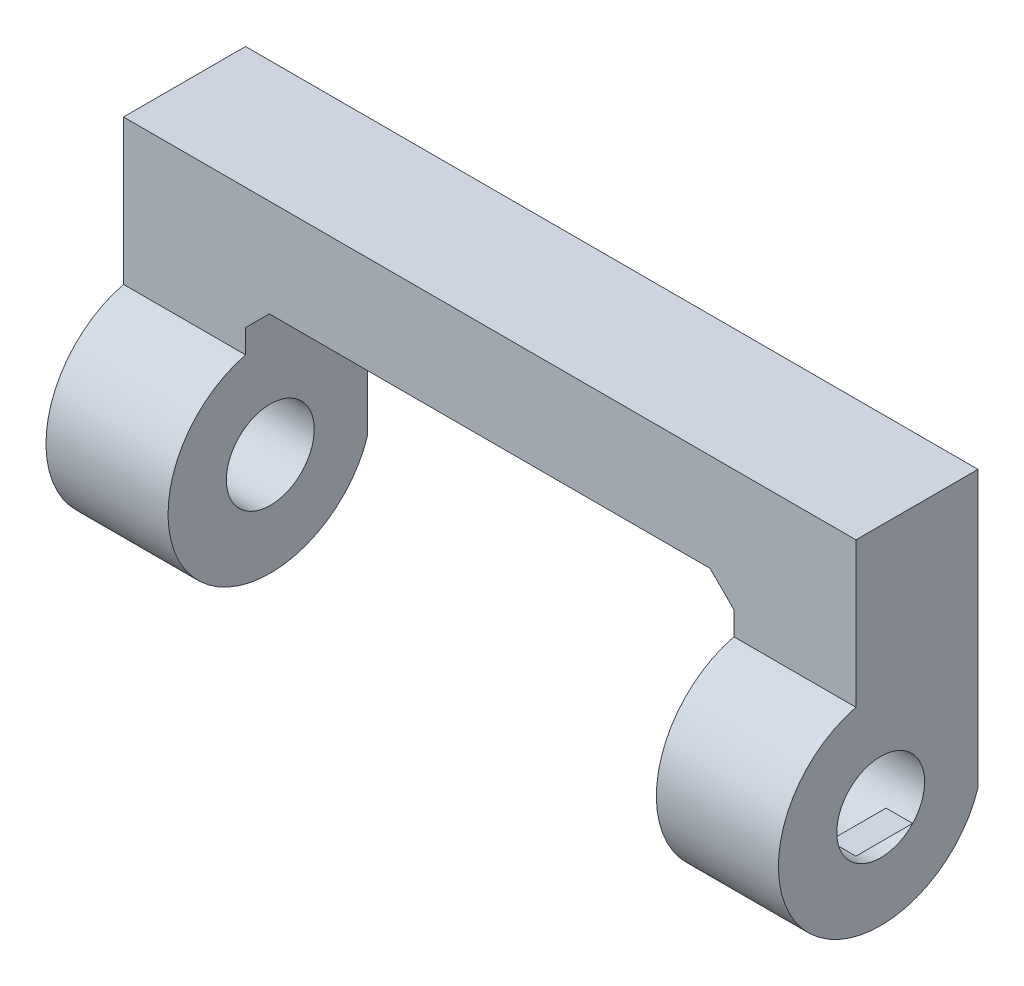
from build123d import *
from build123d.topology import SkipClean

# Parameters (mm, degrees)
BOSS_EXTRUDE1_DEPTH = 5
CUT_EXTRUDE1_DEPTH  = 50.648505088
SKETCH2_3_R         = 1.799674582
BOSS_EXTRUDE2_DEPTH = 5
SKETCH3_R           = 1.799674582
BOSS_EXTRUDE3_DEPTH = 5


with BuildPart() as part:
    # Model → Boss-Extrude1 (new body)
    with BuildSketch(Plane.XY):
        Polygon((319.643988705, 39.239445651), (289.639989597, 39.239424468), (289.639989597, 28.016886869), (294.639989597, 28.020075702), (294.639989597, 34.266605248), (295.614474597, 35.240900181), (304.640051213, 35.240024382), (313.667685024, 35.239144856), (314.643988705, 34.264659856), (314.643988705, 34.263422299), (314.643988705, 28.018126256), (319.643988705, 28.016541689), align=None)
    extrude(amount=BOSS_EXTRUDE1_DEPTH)

    # Sketch2 → Cut-Extrude1 (cut, through all)
    with BuildSketch(Plane.ZY.offset(-289.639989597)):
        with BuildLine():
            ThreePointArc((5, 30.738550482), (2.616874768, 30.420409758), (2.676683755, 28.016886869))
            Line((2.676683755, 28.016886869), (5, 28.016886869))
            Line((5, 28.016886869), (5, 30.738550482))
        make_face()
    extrude(amount=-CUT_EXTRUDE1_DEPTH, mode=Mode.SUBTRACT)

    # Sketch2<3> → Boss-Extrude2 (add)
    with BuildSketch(Plane.ZY.offset(-289.639989597)):
        with BuildLine():
            Line((0, 30.526457448), (0, 27.942741433))
            ThreePointArc((0, 27.942741433), (8.175740848, 29.23459944), (0, 30.526457448))
        make_face()
        with Locations((3.985657063, 29.251964795)):
            Circle(SKETCH2_3_R, mode=Mode.SUBTRACT)
    extrude(amount=-BOSS_EXTRUDE2_DEPTH)

    # Sketch3 → Boss-Extrude3 (add)
    with SkipClean():  # the faces are left unmerged after this step: merging them gives an invalid solid
        with BuildSketch(Plane.ZY.offset(-314.643988705)):
            with BuildLine():
                Line((4.35e-07, 30.526456106), (4.35e-07, 27.942740092))
                ThreePointArc((4.35e-07, 27.942740092), (8.175741283, 29.234598099), (4.35e-07, 30.526456106))
            make_face()
            with Locations((3.985657498, 29.251963453)):
                Circle(SKETCH3_R, mode=Mode.SUBTRACT)
        extrude(amount=-BOSS_EXTRUDE3_DEPTH)


solid = part.part
